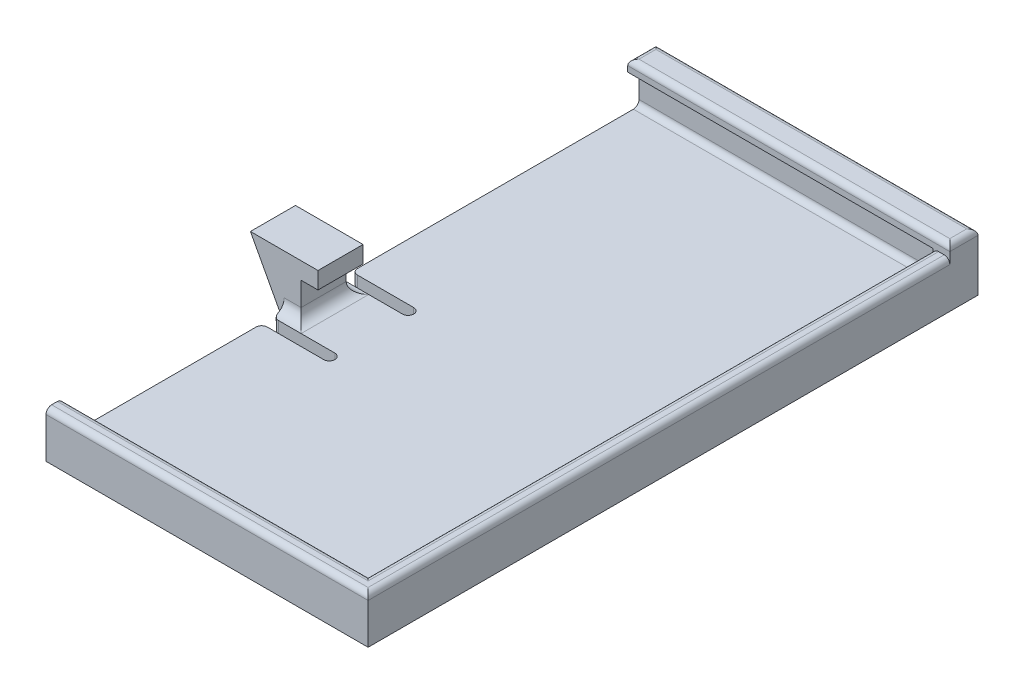
from build123d import *

# Parameters (mm, degrees)
SKETCH2_W           = 28.600197044
SKETCH2_H           = 54.15
BOSS_EXTRUDE1_DEPTH = 1
SKETCH2_3_W         = 28.600197044
SKETCH2_3_H         = 54.15
SKETCH2_3_W_2       = 25.600197044
SKETCH2_3_H_2       = 51.15
BOSS_EXTRUDE2_DEPTH = 3.1
SKETCH3_W           = 25.88588247
SKETCH3_H           = 51.15
CUT_EXTRUDE1_DEPTH  = 3.1
BOSS_EXTRUDE3_DEPTH = 4
SKETCH5_W           = 28.600197044
SKETCH5_H           = 2.5
BOSS_EXTRUDE4_DEPTH = 1
FILLET1_R           = 1
FILLET2_R           = 0.5
SKETCH7_W           = 6
SKETCH7_H           = 1
CUT_EXTRUDE2_DEPTH  = 1
FILLET3_R           = 0.5
FILLET4_R           = 0.5


with BuildPart() as part:
    # Sketch2 → Boss-Extrude1 (new body)
    with BuildSketch(Plane(origin=(0, 0, 0), x_dir=(1, 0, 0), z_dir=(0, 1, 0))):
        Rectangle(SKETCH2_W, SKETCH2_H)
    extrude(amount=-BOSS_EXTRUDE1_DEPTH)

    # Sketch2<3> → Boss-Extrude2 (add)
    with BuildSketch(Plane(origin=(0, 0, 0), x_dir=(1, 0, 0), z_dir=(0, 1, 0))):
        Rectangle(SKETCH2_3_W, SKETCH2_3_H)
        Rectangle(SKETCH2_3_W_2, SKETCH2_3_H_2, mode=Mode.SUBTRACT)
    extrude(amount=BOSS_EXTRUDE2_DEPTH)

    # Sketch3 → Cut-Extrude1 (cut)
    with BuildSketch(Plane(origin=(0, 3.1, 0), x_dir=(1, 0, 0), z_dir=(0, 1, 0))):
        with Locations((-6.642842713, 0)):
            Rectangle(SKETCH3_W, SKETCH3_H)
    extrude(amount=-CUT_EXTRUDE1_DEPTH, mode=Mode.SUBTRACT)

    # Sketch4 → Boss-Extrude3 (add)
    with BuildSketch(Plane.XY.offset(1.925)):
        Polygon((-14.300098522, 0), (-12.800098522, 0), (-12.800098522, 3.1), (-11.300098522, 3.1), (-11.300098522, 4.6), (-17.300098522, 4.6), (-14.300098522, -1), align=None)
    extrude(amount=BOSS_EXTRUDE3_DEPTH)

    # Sketch5 → Boss-Extrude4 (add)
    with BuildSketch(Plane(origin=(0, 3.1, 0), x_dir=(1, 0, 0), z_dir=(0, 1, 0))):
        with Locations((0, 25.825)):
            Rectangle(SKETCH5_W, SKETCH5_H)
    extrude(amount=BOSS_EXTRUDE4_DEPTH)

    # Fillet1
    fillet1_edges = [part.edges().sort_by_distance(p)[0] for p in [
        (-13.550098522, 0, 1.925),
        (-12.800098522, 0, 3.925),
        (-13.550098522, 0, 5.925),
    ]]
    fillet(fillet1_edges, radius=FILLET1_R)

    # Fillet2
    fillet2_edges = [part.edges().sort_by_distance(p)[0] for p in [
        (14.300098522, 3.1, 1.25),
        (0, 3.1, 27.075),
        (12.800098522, 3.1, 0.5),
        (-0.75, 3.1, 25.575),
        (-14.300098522, 4.1, -25.825),
        (0, 4.1, -24.575),
        (14.300098522, 4.1, -25.825),
        (0, 4.1, -27.075),
    ]]
    fillet(fillet2_edges, radius=FILLET2_R)

    # Sketch7 → Cut-Extrude2 (cut)
    with BuildSketch(Plane(origin=(0, 0, 0), x_dir=(1, 0, 0), z_dir=(0, 1, 0))):
        with Locations((-11.300098522, -0.425)):
            Rectangle(SKETCH7_W, SKETCH7_H)
        with Locations((-11.300098522, -7.425)):
            Rectangle(SKETCH7_W, SKETCH7_H)
    extrude(amount=-CUT_EXTRUDE2_DEPTH, mode=Mode.SUBTRACT)

    # Fillet3
    fillet3_edges = [part.edges().sort_by_distance(p)[0] for p in [
        (-14.300098522, -0.5, 0.925),
        (-14.300098522, -0.5, -0.075),
        (-8.300098522, -0.5, -0.075),
        (-8.300098522, -0.5, 0.925),
        (-14.300098522, -0.5, 7.925),
        (-14.300098522, -0.5, 6.925),
        (-8.300098522, -0.5, 6.925),
        (-8.300098522, -0.5, 7.925),
    ]]
    fillet(fillet3_edges, radius=FILLET3_R - 0.0001)  # a hair under: the kernel refuses the full size

    # Fillet4
    fillet4_edges = [part.edges().sort_by_distance(p)[0] for p in [
        (12.800098522, 0, 0),
        (-0.75, 0, -25.575),
        (-0.75, 0, 25.575),
    ]]
    fillet(fillet4_edges, radius=FILLET4_R)


solid = part.part
